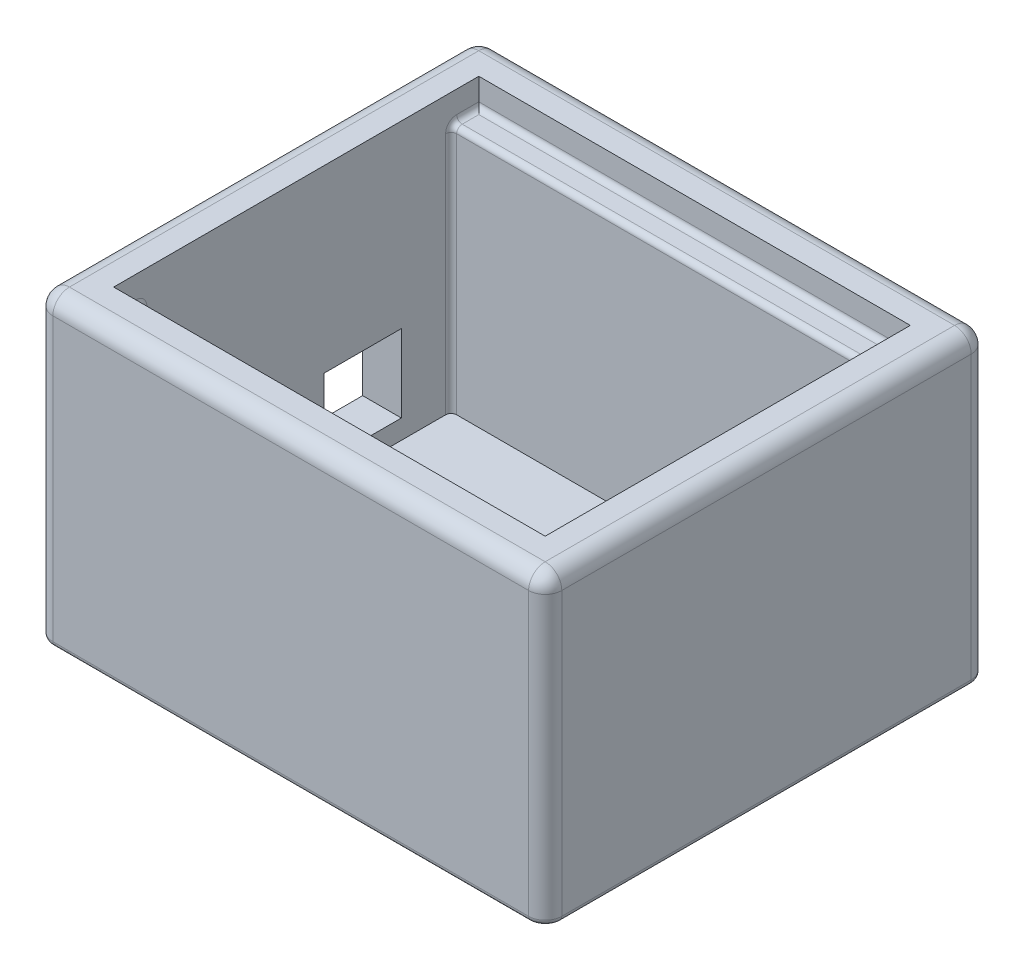
from build123d import *

# Parameters (mm, degrees)
SKETCH1_W           = 92
SKETCH1_H           = 80
BOSS_EXTRUDE1_DEPTH = 55
SKETCH2_W           = 78
SKETCH2_H           = 56
CUT_EXTRUDE1_DEPTH  = 50
SKETCH3_W           = 78
SKETCH3_H           = 5
CUT_EXTRUDE2_DEPTH  = 5
FILLET_TOP_R        = 3
FILLET_EDGES_R      = 3
FILLET_BOTTOM_R     = 1
FILLET4_R           = 1
CUT_EXTRUDE4_REACH  = 135.75
SKETCH5_W           = 14
SKETCH5_H           = 14


with BuildPart() as part:
    # Sketch1 → Boss-Extrude1 (new body)
    with BuildSketch(Plane(origin=(0, 0, 0), x_dir=(1, 0, 0), z_dir=(0, 1, 0))):
        with Locations((46, -40)):
            Rectangle(SKETCH1_W, SKETCH1_H)
    extrude(amount=BOSS_EXTRUDE1_DEPTH)

    # Sketch2 → Cut-Extrude1 (cut)
    with BuildSketch(Plane(origin=(0, 55, 0), x_dir=(1, 0, 0), z_dir=(0, 1, 0))):
        with Locations((46, -40)):
            Rectangle(SKETCH2_W, SKETCH2_H)
    extrude(amount=-CUT_EXTRUDE1_DEPTH, mode=Mode.SUBTRACT)

    # Sketch3 → Cut-Extrude2 (cut)
    with BuildSketch(Plane(origin=(0, 55, 0), x_dir=(1, 0, 0), z_dir=(0, 1, 0))):
        with Locations((46, -9.5)):
            Rectangle(SKETCH3_W, SKETCH3_H)
        with Locations((46, -70.5)):
            Rectangle(SKETCH3_W, SKETCH3_H)
    extrude(amount=-CUT_EXTRUDE2_DEPTH, mode=Mode.SUBTRACT)

    # Fillet_top
    fillet_top_edges = [part.edges().sort_by_distance(p)[0] for p in [
        (92, 55, 40),
        (46, 55, 0),
        (0, 55, 40),
        (46, 55, 80),
    ]]
    fillet(fillet_top_edges, radius=FILLET_TOP_R)

    # Fillet_edges
    # the kernel refuses this fillet: 3 mm, written as the material it takes off along each edge
    with BuildSketch(Plane(origin=(3, 52, 77), x_dir=(0, 0, 1), z_dir=(-1, 0, 0))) as fillet_edges_piece_1_section:
        Polygon((0, 0), (FILLET_EDGES_R, 0), (FILLET_EDGES_R, FILLET_EDGES_R), (0, FILLET_EDGES_R), align=None)
    fillet_edges_piece_1 = extrude(amount=FILLET_EDGES_R, mode=Mode.PRIVATE)
    fillet_edges_piece_1 = fillet_edges_piece_1 - Plane(origin=(3, 52, 77), x_dir=(0, -0.7071067811865475, -0.7071067811865475), z_dir=(-1, 0, 0)) * Sphere(FILLET_EDGES_R, mode=Mode.PRIVATE)
    add(fillet_edges_piece_1, mode=Mode.SUBTRACT)
    with BuildSketch(Plane(origin=(3, 52, 3), x_dir=(-1, 0, 0), z_dir=(0, 0, -1))) as fillet_edges_piece_2_section:
        Polygon((0, 0), (FILLET_EDGES_R, 0), (FILLET_EDGES_R, FILLET_EDGES_R), (0, FILLET_EDGES_R), align=None)
    fillet_edges_piece_2 = extrude(amount=FILLET_EDGES_R, mode=Mode.PRIVATE)
    fillet_edges_piece_2 = fillet_edges_piece_2 - Plane(origin=(3, 52, 3), x_dir=(0.7071067811865475, -0.7071067811865475, 0), z_dir=(0, 0, -1)) * Sphere(FILLET_EDGES_R, mode=Mode.PRIVATE)
    add(fillet_edges_piece_2, mode=Mode.SUBTRACT)
    with BuildSketch(Plane(origin=(89, 52, 77), x_dir=(0, 0, 1), z_dir=(1, 0, 0))) as fillet_edges_piece_3_section:
        Polygon((0, 0), (FILLET_EDGES_R, 0), (FILLET_EDGES_R, -FILLET_EDGES_R), (0, -FILLET_EDGES_R), align=None)
    fillet_edges_piece_3 = extrude(amount=FILLET_EDGES_R, mode=Mode.PRIVATE)
    fillet_edges_piece_3 = fillet_edges_piece_3 - Plane(origin=(89, 52, 77), x_dir=(0, -0.7071067811865475, -0.7071067811865475), z_dir=(1, 0, 0)) * Sphere(FILLET_EDGES_R, mode=Mode.PRIVATE)
    add(fillet_edges_piece_3, mode=Mode.SUBTRACT)
    with BuildSketch(Plane(origin=(89, 52, 3), x_dir=(1, 0, 0), z_dir=(0, 0, -1))) as fillet_edges_piece_4_section:
        Polygon((0, 0), (FILLET_EDGES_R, 0), (FILLET_EDGES_R, -FILLET_EDGES_R), (0, -FILLET_EDGES_R), align=None)
    fillet_edges_piece_4 = extrude(amount=FILLET_EDGES_R, mode=Mode.PRIVATE)
    fillet_edges_piece_4 = fillet_edges_piece_4 - Plane(origin=(89, 52, 3), x_dir=(-0.7071067811865475, -0.7071067811865475, 0), z_dir=(0, 0, -1)) * Sphere(FILLET_EDGES_R, mode=Mode.PRIVATE)
    add(fillet_edges_piece_4, mode=Mode.SUBTRACT)
    with BuildSketch(Plane(origin=(92, -7.5, 0), x_dir=(-1, 0, 0), z_dir=(0, 1, 0)), Plane(origin=(92, -7.5, 80), x_dir=(0, 0, -1), z_dir=(0, 1, 0))) as fillet_edges_piece_5:
        with BuildLine():
            CenterArc((FILLET_EDGES_R, FILLET_EDGES_R), FILLET_EDGES_R, 180, 90)
            Line((0, FILLET_EDGES_R), (0, 0))
            Line((0, 0), (FILLET_EDGES_R, 0))
        make_face()
    extrude(amount=59.5, mode=Mode.SUBTRACT)
    with BuildSketch(Plane(origin=(0, -7.5, 80), x_dir=(0, 0, -1), z_dir=(0, 1, 0)), Plane(origin=(0, -7.5, 0), x_dir=(1, 0, 0), z_dir=(0, 1, 0))) as fillet_edges_piece_6:
        with BuildLine():
            CenterArc((FILLET_EDGES_R, -FILLET_EDGES_R), FILLET_EDGES_R, 90, 90)
            Line((0, -FILLET_EDGES_R), (0, 0))
            Line((0, 0), (FILLET_EDGES_R, 0))
        make_face()
    extrude(amount=59.5, mode=Mode.SUBTRACT)

    # Fillet_bottom
    fillet_bottom_edges = [part.edges().sort_by_distance(p)[0] for p in [
        (0, 0, 40),
        (46, 0, 0),
        (92, 0, 40),
        (46, 0, 80),
        (0.878679656, 0, 79.121320344),
        (91.121320344, 0, 79.121320344),
        (91.121320344, 0, 0.878679656),
        (0.878679656, 0, 0.878679656),
    ]]
    fillet(fillet_bottom_edges, radius=FILLET_BOTTOM_R)

    # Fillet4
    fillet4_edges = [part.edges().sort_by_distance(p)[0] for p in [
        (7, 27.5, 68),
        (7, 27.5, 12),
        (85, 27.5, 12),
        (85, 27.5, 68),
        (46, 50, 12),
        (7, 50, 9.5),
        (46, 50, 7),
        (85, 50, 9.5),
        (46, 50, 68),
        (85, 50, 70.5),
        (46, 50, 73),
        (7, 50, 70.5),
    ]]
    fillet(fillet4_edges, radius=FILLET4_R)

    # Sketch5 → Cut-Extrude4 (cut, up to next)
    with BuildSketch(Plane.ZY, mode=Mode.PRIVATE) as cut_extrude4_sk1:
        with Locations((28, 15.5)):
            Rectangle(SKETCH5_W, SKETCH5_H)
    cut_extrude4_tool1 = extrude(cut_extrude4_sk1.sketch, amount=-CUT_EXTRUDE4_REACH, mode=Mode.PRIVATE) & part.part
    add(cut_extrude4_tool1.solids().sort_by_distance((0, 15.5, 28))[0], mode=Mode.SUBTRACT)


solid = part.part
